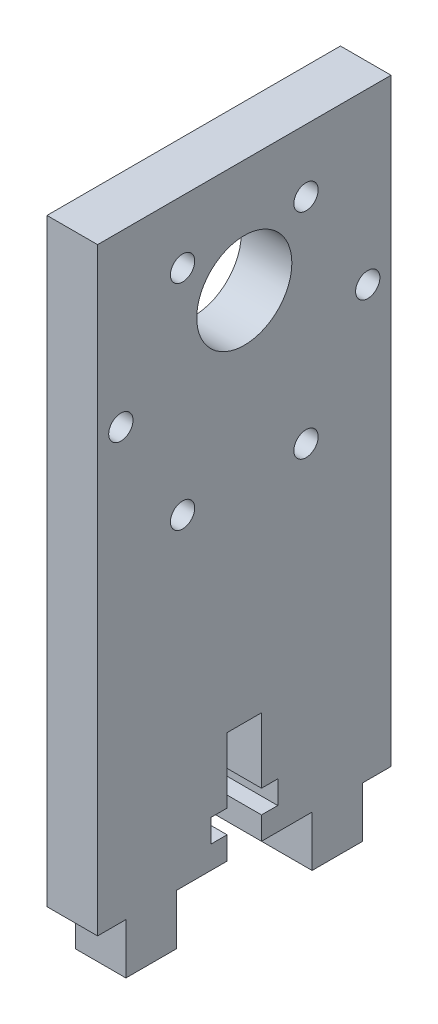
from build123d import *

# Parameters (mm, degrees)
MOTOR_PLATE_R       = 1.524
MOTOR_PLATE_R_2     = 5.969
BOSS_EXTRUDE1_DEPTH = 6.35


with BuildPart() as part:
    # Motor plate → Boss-Extrude1 (new body)
    with BuildSketch(Plane(origin=(0, 0, 0), x_dir=(0, 0, -1), z_dir=(1, 0, 0))):
        Polygon((-18.415, 37.570098803), (-18.415, -37.570098803), (-14.859, -37.570098803), (-14.859, -43.920098803), (-8.509, -43.920098803), (-8.509, -37.570098803), (-2.159, -37.570098803), (-2.159, -34.702395821), (-4.199999982, -34.702395821), (-4.199999982, -31.802395779), (-2.159, -31.802395779), (-2.159, -23.600098803), (2.159, -23.600098803), (2.159, -31.802395779), (4.199999982, -31.802395779), (4.199999982, -34.702395821), (2.159, -34.702395821), (2.159, -37.570098803), (8.509, -37.570098803), (8.509, -43.920098803), (14.859, -43.920098803), (14.859, -37.570098803), (18.415, -37.570098803), (18.415, 37.570098803), align=None)
        with Locations((-15.494, 16.277901197)):
            Circle(MOTOR_PLATE_R, mode=Mode.SUBTRACT)
        with Locations((-7.747, 2.859703591)):
            Circle(MOTOR_PLATE_R, mode=Mode.SUBTRACT)
        with Locations((0, 23.389901197)):
            Circle(MOTOR_PLATE_R_2, mode=Mode.SUBTRACT)
        with Locations((-7.747, 29.696098803)):
            Circle(MOTOR_PLATE_R, mode=Mode.SUBTRACT)
        with Locations((7.747, 2.859703591)):
            Circle(MOTOR_PLATE_R, mode=Mode.SUBTRACT)
        with Locations((15.494, 16.277901197)):
            Circle(MOTOR_PLATE_R, mode=Mode.SUBTRACT)
        with Locations((7.747, 29.696098803)):
            Circle(MOTOR_PLATE_R, mode=Mode.SUBTRACT)
    extrude(amount=BOSS_EXTRUDE1_DEPTH)


solid = part.part
